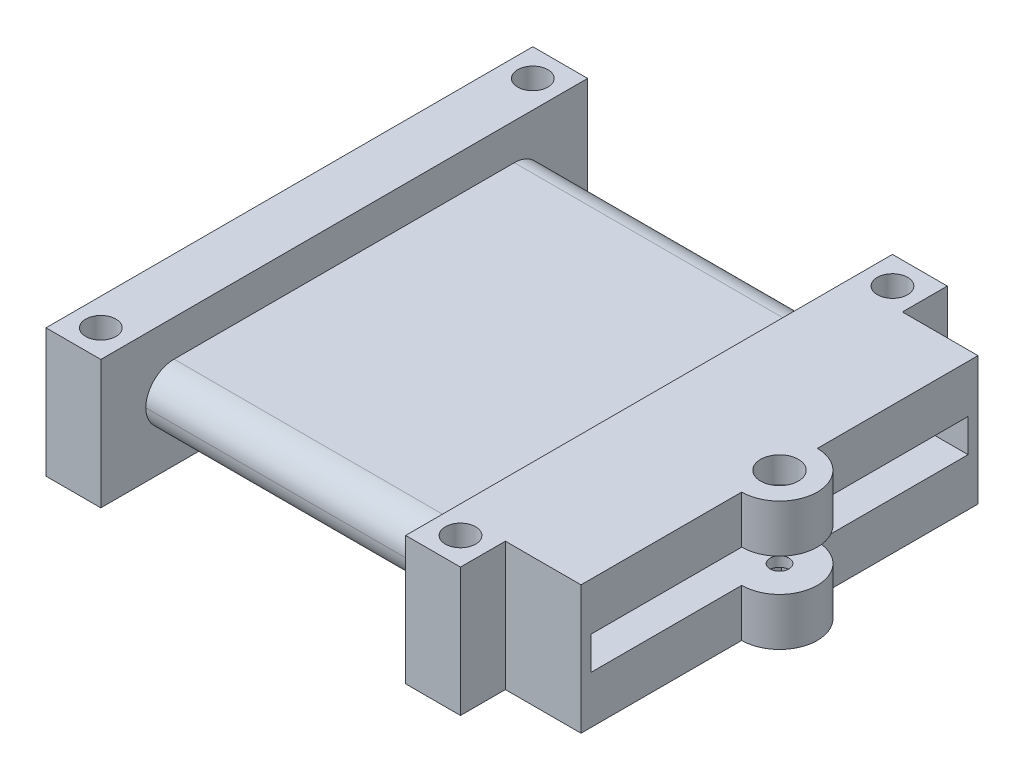
from build123d import *

# Parameters (mm, degrees)
SKETCH1_W           = 42
SKETCH1_H           = 5.9
SKETCH1_W_2         = 39.9
SKETCH1_H_2         = 3.5
BOSS_EXTRUDE1_DEPTH = 32.25
FILLET2_R           = 3
SKETCH2_W           = 51.5
SKETCH2_H           = 13.6
SKETCH2_W_2         = 39.9
SKETCH2_H_2         = 3.5
BOSS_EXTRUDE2_DEPTH = 5.8
SKETCH3_W           = 51.5
SKETCH3_H           = 13.6
SKETCH3_W_2         = 39.9
SKETCH3_H_2         = 3.5
BOSS_EXTRUDE3_DEPTH = 5.8
SKETCH4_R           = 1.6
CUT_EXTRUDE1_DEPTH  = 62.792596644
BOSS_EXTRUDE4_DEPTH = 13.6
CUT_EXTRUDE4_DEPTH  = 4
SKETCH15_W          = 39.9
SKETCH15_H          = 3.5
CUT_EXTRUDE5_DEPTH  = 74.483654645


with BuildPart() as part:
    # Sketch1 → Boss-Extrude1 (new body)
    with BuildSketch(Plane(origin=(0, 0, 0), x_dir=(0, 0, -1), z_dir=(1, 0, 0))):
        with Locations((21, 2.95)):
            Rectangle(SKETCH1_W, SKETCH1_H)
        with Locations((21, 2.95)):
            Rectangle(SKETCH1_W_2, SKETCH1_H_2, mode=Mode.SUBTRACT)
    extrude(amount=BOSS_EXTRUDE1_DEPTH)

    # Fillet2
    # the kernel refuses this fillet: 3 mm, written as the material it takes off along each edge
    with BuildSketch(Plane(origin=(-7.5, 0, -42), x_dir=(0, 0, 1), z_dir=(1, 0, 0)), Plane(origin=(-7.5, 5.9, 0), x_dir=(0, 0, -1), z_dir=(1, 0, 0)), Plane(origin=(-7.5, 5.9, -42), x_dir=(0, -1, 0), z_dir=(1, 0, 0))) as fillet2_piece_1:
        with BuildLine():
            CenterArc((FILLET2_R, -FILLET2_R), FILLET2_R, 90, 90)
            Line((0, -FILLET2_R), (0, 0))
            Line((0, 0), (FILLET2_R, 0))
        make_face()
    extrude(amount=47.25, mode=Mode.SUBTRACT)
    with BuildSketch(Plane(origin=(-7.5, 0, 0), x_dir=(0, 0, -1), z_dir=(1, 0, 0))) as fillet2_piece_2:
        with BuildLine():
            CenterArc((FILLET2_R, FILLET2_R), FILLET2_R, 180, 90)
            Line((0, FILLET2_R), (0, 0))
            Line((0, 0), (FILLET2_R, 0))
        make_face()
    extrude(amount=47.25, mode=Mode.SUBTRACT)

    # Sketch2 → Boss-Extrude2 (add)
    with BuildSketch(Plane(origin=(32.25, 0, 0), x_dir=(0, 0, -1), z_dir=(1, 0, 0))):
        with Locations((21, 2.95)):
            Rectangle(SKETCH2_W, SKETCH2_H)
        with Locations((21, 2.95)):
            Rectangle(SKETCH2_W_2, SKETCH2_H_2, mode=Mode.SUBTRACT)
    extrude(amount=BOSS_EXTRUDE2_DEPTH)

    # Sketch3 → Boss-Extrude3 (add)
    with BuildSketch(Plane.ZY):
        with Locations((-21, 2.95)):
            Rectangle(SKETCH3_W, SKETCH3_H)
        with Locations((-21, 2.95)):
            Rectangle(SKETCH3_W_2, SKETCH3_H_2, mode=Mode.SUBTRACT)
    extrude(amount=BOSS_EXTRUDE3_DEPTH)

    # Sketch4 → Cut-Extrude1 (cut, through all)
    with BuildSketch(Plane(origin=(0, 9.75, 0), x_dir=(1, 0, 0), z_dir=(0, 1, 0))):
        with Locations(Location((-2.9, 43.85, 0), (0, 0, 270))):
            Circle(SKETCH4_R)
        with Locations(Location((35.15, 43.85, 0), (0, 0, 270))):
            Circle(SKETCH4_R)
        with Locations(Location((-2.9, -1.85, 0), (0, 0, 270))):
            Circle(SKETCH4_R)
        with Locations(Location((35.15, -1.85, 0), (0, 0, 270))):
            Circle(SKETCH4_R)
    extrude(amount=-CUT_EXTRUDE1_DEPTH, mode=Mode.SUBTRACT)

    # Sketch8 → Boss-Extrude4 (add)
    with BuildSketch(Plane(origin=(0, 9.75, 0), x_dir=(1, 0, 0), z_dir=(0, 1, 0))):
        with BuildLine():
            ThreePointArc((46.05, 17), (50.05, 21), (46.05, 25))
            Line((46.05, 25), (46.05, 41.999583304))
            Line((46.05, 41.999583304), (38.05, 41.999583304))
            Line((38.05, 41.999583304), (38.05, 0.000416696))
            Line((38.05, 0.000416696), (46.05, 0.000416696))
            Line((46.05, 0.000416696), (46.05, 17))
        make_face()
    extrude(amount=-BOSS_EXTRUDE4_DEPTH)

    # Sketch13 → CSK for M2 Flat Head Machine Screw1 (revolve, cut)
    with BuildSketch(Plane(origin=(46.05, 9.75, -21), x_dir=(0, 0, 1), z_dir=(1, 0, 0))):
        Polygon((0, 0), (0, 13.6), (1, 13.6), (1, 3.75), (2, 2.75), (2, 0), align=None)
    revolve(axis=Axis((46.05, 16.1, -21), (0, -1, 0)), mode=Mode.SUBTRACT)

    # Sketch14 → Cut-Extrude4 (cut)
    with BuildSketch(Plane.XZ.offset(3.85)):
        Polygon((43.671623782, -20.5274256), (44.451550455, -22.823447025), (46.829926673, -23.296021425), (48.428376218, -21.4725744), (47.648449545, -19.176552975), (45.270073327, -18.703978575), align=None)
    extrude(amount=-CUT_EXTRUDE4_DEPTH, mode=Mode.SUBTRACT)

    # Sketch15 → Cut-Extrude5 (cut, through all)
    with BuildSketch(Plane.ZY.offset(5.8)):
        with Locations((-21, 2.95)):
            Rectangle(SKETCH15_W, SKETCH15_H)
    extrude(amount=-CUT_EXTRUDE5_DEPTH, mode=Mode.SUBTRACT)


solid = part.part
